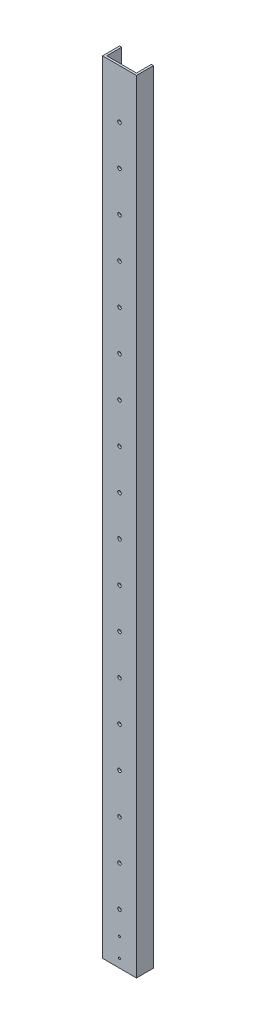
from build123d import *

# Parameters (mm, degrees)
BOSS_EXTRUDE1_DEPTH = 1168.4
CUT_EXTRUDE1_REACH  = 1171.78
SKETCH2_R           = 2.667
CUT_EXTRUDE2_REACH  = 1171.78
SKETCH4_R           = 1.5875


with BuildPart() as part:
    # Sketch1 → Boss-Extrude1 (new body)
    with BuildSketch(Plane(origin=(0, 0, 0), x_dir=(1, 0, 0), z_dir=(0, 1, 0))):
        Polygon((3.175, 3.175), (3.175, 25.4), (0, 25.4), (0, 0), (50.8, 0), (50.8, 25.4), (47.625, 25.4), (47.625, 3.175), align=None)
    extrude(amount=BOSS_EXTRUDE1_DEPTH)

    # Sketch2 → Cut-Extrude1 (cut, up to next)
    with BuildSketch(Plane.XY, mode=Mode.PRIVATE) as cut_extrude1_sk1:
        with Locations((25.4, 76.2)):
            Circle(SKETCH2_R)
    cut_extrude1_tool1 = extrude(cut_extrude1_sk1.sketch, amount=-CUT_EXTRUDE1_REACH, mode=Mode.PRIVATE) & part.part
    # Sketch2 → Cut-Extrude1 (cut, up to next)
    with BuildSketch(Plane.XY, mode=Mode.PRIVATE) as cut_extrude1_sk2:
        with Locations((25.4, 136.144)):
            Circle(SKETCH2_R)
    cut_extrude1_tool2 = extrude(cut_extrude1_sk2.sketch, amount=-CUT_EXTRUDE1_REACH, mode=Mode.PRIVATE) & part.part
    # Sketch2 → Cut-Extrude1 (cut, up to next)
    with BuildSketch(Plane.XY, mode=Mode.PRIVATE) as cut_extrude1_sk3:
        with Locations((25.4, 196.088)):
            Circle(SKETCH2_R)
    cut_extrude1_tool3 = extrude(cut_extrude1_sk3.sketch, amount=-CUT_EXTRUDE1_REACH, mode=Mode.PRIVATE) & part.part
    # Sketch2 → Cut-Extrude1 (cut, up to next)
    with BuildSketch(Plane.XY, mode=Mode.PRIVATE) as cut_extrude1_sk4:
        with Locations((25.4, 256.032)):
            Circle(SKETCH2_R)
    cut_extrude1_tool4 = extrude(cut_extrude1_sk4.sketch, amount=-CUT_EXTRUDE1_REACH, mode=Mode.PRIVATE) & part.part
    # Sketch2 → Cut-Extrude1 (cut, up to next)
    with BuildSketch(Plane.XY, mode=Mode.PRIVATE) as cut_extrude1_sk5:
        with Locations((25.4, 315.976)):
            Circle(SKETCH2_R)
    cut_extrude1_tool5 = extrude(cut_extrude1_sk5.sketch, amount=-CUT_EXTRUDE1_REACH, mode=Mode.PRIVATE) & part.part
    # Sketch2 → Cut-Extrude1 (cut, up to next)
    with BuildSketch(Plane.XY, mode=Mode.PRIVATE) as cut_extrude1_sk6:
        with Locations((25.4, 375.92)):
            Circle(SKETCH2_R)
    cut_extrude1_tool6 = extrude(cut_extrude1_sk6.sketch, amount=-CUT_EXTRUDE1_REACH, mode=Mode.PRIVATE) & part.part
    # Sketch2 → Cut-Extrude1 (cut, up to next)
    with BuildSketch(Plane.XY, mode=Mode.PRIVATE) as cut_extrude1_sk7:
        with Locations((25.4, 435.864)):
            Circle(SKETCH2_R)
    cut_extrude1_tool7 = extrude(cut_extrude1_sk7.sketch, amount=-CUT_EXTRUDE1_REACH, mode=Mode.PRIVATE) & part.part
    # Sketch2 → Cut-Extrude1 (cut, up to next)
    with BuildSketch(Plane.XY, mode=Mode.PRIVATE) as cut_extrude1_sk8:
        with Locations((25.4, 495.808)):
            Circle(SKETCH2_R)
    cut_extrude1_tool8 = extrude(cut_extrude1_sk8.sketch, amount=-CUT_EXTRUDE1_REACH, mode=Mode.PRIVATE) & part.part
    # Sketch2 → Cut-Extrude1 (cut, up to next)
    with BuildSketch(Plane.XY, mode=Mode.PRIVATE) as cut_extrude1_sk9:
        with Locations((25.4, 555.752)):
            Circle(SKETCH2_R)
    cut_extrude1_tool9 = extrude(cut_extrude1_sk9.sketch, amount=-CUT_EXTRUDE1_REACH, mode=Mode.PRIVATE) & part.part
    # Sketch2 → Cut-Extrude1 (cut, up to next)
    with BuildSketch(Plane.XY, mode=Mode.PRIVATE) as cut_extrude1_sk10:
        with Locations((25.4, 615.696)):
            Circle(SKETCH2_R)
    cut_extrude1_tool10 = extrude(cut_extrude1_sk10.sketch, amount=-CUT_EXTRUDE1_REACH, mode=Mode.PRIVATE) & part.part
    # Sketch2 → Cut-Extrude1 (cut, up to next)
    with BuildSketch(Plane.XY, mode=Mode.PRIVATE) as cut_extrude1_sk11:
        with Locations((25.4, 675.64)):
            Circle(SKETCH2_R)
    cut_extrude1_tool11 = extrude(cut_extrude1_sk11.sketch, amount=-CUT_EXTRUDE1_REACH, mode=Mode.PRIVATE) & part.part
    # Sketch2 → Cut-Extrude1 (cut, up to next)
    with BuildSketch(Plane.XY, mode=Mode.PRIVATE) as cut_extrude1_sk12:
        with Locations((25.4, 735.584)):
            Circle(SKETCH2_R)
    cut_extrude1_tool12 = extrude(cut_extrude1_sk12.sketch, amount=-CUT_EXTRUDE1_REACH, mode=Mode.PRIVATE) & part.part
    # Sketch2 → Cut-Extrude1 (cut, up to next)
    with BuildSketch(Plane.XY, mode=Mode.PRIVATE) as cut_extrude1_sk13:
        with Locations((25.4, 795.528)):
            Circle(SKETCH2_R)
    cut_extrude1_tool13 = extrude(cut_extrude1_sk13.sketch, amount=-CUT_EXTRUDE1_REACH, mode=Mode.PRIVATE) & part.part
    # Sketch2 → Cut-Extrude1 (cut, up to next)
    with BuildSketch(Plane.XY, mode=Mode.PRIVATE) as cut_extrude1_sk14:
        with Locations((25.4, 855.472)):
            Circle(SKETCH2_R)
    cut_extrude1_tool14 = extrude(cut_extrude1_sk14.sketch, amount=-CUT_EXTRUDE1_REACH, mode=Mode.PRIVATE) & part.part
    # Sketch2 → Cut-Extrude1 (cut, up to next)
    with BuildSketch(Plane.XY, mode=Mode.PRIVATE) as cut_extrude1_sk15:
        with Locations((25.4, 915.416)):
            Circle(SKETCH2_R)
    cut_extrude1_tool15 = extrude(cut_extrude1_sk15.sketch, amount=-CUT_EXTRUDE1_REACH, mode=Mode.PRIVATE) & part.part
    # Sketch2 → Cut-Extrude1 (cut, up to next)
    with BuildSketch(Plane.XY, mode=Mode.PRIVATE) as cut_extrude1_sk16:
        with Locations((25.4, 975.36)):
            Circle(SKETCH2_R)
    cut_extrude1_tool16 = extrude(cut_extrude1_sk16.sketch, amount=-CUT_EXTRUDE1_REACH, mode=Mode.PRIVATE) & part.part
    # Sketch2 → Cut-Extrude1 (cut, up to next)
    with BuildSketch(Plane.XY, mode=Mode.PRIVATE) as cut_extrude1_sk17:
        with Locations((25.4, 1035.304)):
            Circle(SKETCH2_R)
    cut_extrude1_tool17 = extrude(cut_extrude1_sk17.sketch, amount=-CUT_EXTRUDE1_REACH, mode=Mode.PRIVATE) & part.part
    # Sketch2 → Cut-Extrude1 (cut, up to next)
    with BuildSketch(Plane.XY, mode=Mode.PRIVATE) as cut_extrude1_sk18:
        with Locations((25.4, 1095.248)):
            Circle(SKETCH2_R)
    cut_extrude1_tool18 = extrude(cut_extrude1_sk18.sketch, amount=-CUT_EXTRUDE1_REACH, mode=Mode.PRIVATE) & part.part
    add(cut_extrude1_tool1.solids().sort_by_distance((25.4, 76.2, 0))[0], mode=Mode.SUBTRACT)
    add(cut_extrude1_tool2.solids().sort_by_distance((25.4, 136.144, 0))[0], mode=Mode.SUBTRACT)
    add(cut_extrude1_tool3.solids().sort_by_distance((25.4, 196.088, 0))[0], mode=Mode.SUBTRACT)
    add(cut_extrude1_tool4.solids().sort_by_distance((25.4, 256.032, 0))[0], mode=Mode.SUBTRACT)
    add(cut_extrude1_tool5.solids().sort_by_distance((25.4, 315.976, 0))[0], mode=Mode.SUBTRACT)
    add(cut_extrude1_tool6.solids().sort_by_distance((25.4, 375.92, 0))[0], mode=Mode.SUBTRACT)
    add(cut_extrude1_tool7.solids().sort_by_distance((25.4, 435.864, 0))[0], mode=Mode.SUBTRACT)
    add(cut_extrude1_tool8.solids().sort_by_distance((25.4, 495.808, 0))[0], mode=Mode.SUBTRACT)
    add(cut_extrude1_tool9.solids().sort_by_distance((25.4, 555.752, 0))[0], mode=Mode.SUBTRACT)
    add(cut_extrude1_tool10.solids().sort_by_distance((25.4, 615.696, 0))[0], mode=Mode.SUBTRACT)
    add(cut_extrude1_tool11.solids().sort_by_distance((25.4, 675.64, 0))[0], mode=Mode.SUBTRACT)
    add(cut_extrude1_tool12.solids().sort_by_distance((25.4, 735.584, 0))[0], mode=Mode.SUBTRACT)
    add(cut_extrude1_tool13.solids().sort_by_distance((25.4, 795.528, 0))[0], mode=Mode.SUBTRACT)
    add(cut_extrude1_tool14.solids().sort_by_distance((25.4, 855.472, 0))[0], mode=Mode.SUBTRACT)
    add(cut_extrude1_tool15.solids().sort_by_distance((25.4, 915.416, 0))[0], mode=Mode.SUBTRACT)
    add(cut_extrude1_tool16.solids().sort_by_distance((25.4, 975.36, 0))[0], mode=Mode.SUBTRACT)
    add(cut_extrude1_tool17.solids().sort_by_distance((25.4, 1035.304, 0))[0], mode=Mode.SUBTRACT)
    add(cut_extrude1_tool18.solids().sort_by_distance((25.4, 1095.248, 0))[0], mode=Mode.SUBTRACT)

    # Sketch4 → Cut-Extrude2 (cut, up to next)
    with BuildSketch(Plane.XY, mode=Mode.PRIVATE) as cut_extrude2_sk1:
        with Locations((25.4, 41.275)):
            Circle(SKETCH4_R)
    cut_extrude2_tool1 = extrude(cut_extrude2_sk1.sketch, amount=-CUT_EXTRUDE2_REACH, mode=Mode.PRIVATE) & part.part
    # Sketch4 → Cut-Extrude2 (cut, up to next)
    with BuildSketch(Plane.XY, mode=Mode.PRIVATE) as cut_extrude2_sk2:
        with Locations((25.4, 12.7)):
            Circle(SKETCH4_R)
    cut_extrude2_tool2 = extrude(cut_extrude2_sk2.sketch, amount=-CUT_EXTRUDE2_REACH, mode=Mode.PRIVATE) & part.part
    add(cut_extrude2_tool1.solids().sort_by_distance((25.4, 41.275, 0))[0], mode=Mode.SUBTRACT)
    add(cut_extrude2_tool2.solids().sort_by_distance((25.4, 12.7, 0))[0], mode=Mode.SUBTRACT)


solid = part.part
